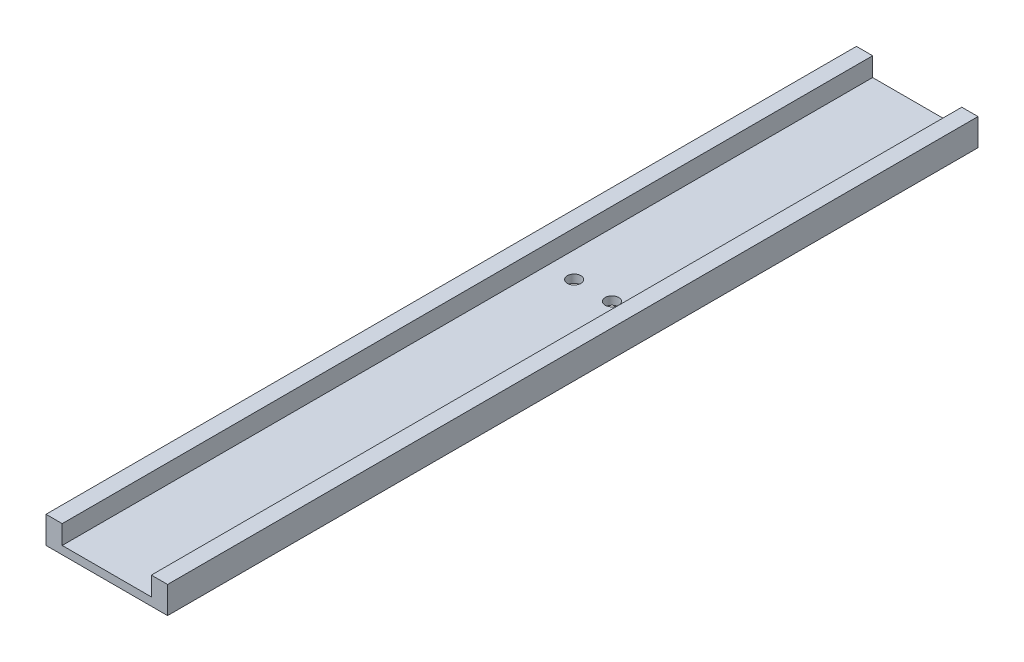
from build123d import *

# Parameters (mm, degrees)
BOSS_EXTRU_1_DEPTH           = 300
ENL_V_MAT_EXTRU_1_DEPTH      = 304.43697863
ENL_V_MAT_EXTRU_1_DEPTH_BACK = 304.43697863
ESQUISSE2_R                  = 2.5


with BuildPart() as part:
    # Esquisse1 → Boss.-Extru.1 (new body)
    with BuildSketch(Plane.XY):
        Polygon((0, 0), (0, 10), (6, 10), (6, 3), (39, 3), (39, 10), (45, 10), (45, 0), align=None)
    extrude(amount=BOSS_EXTRU_1_DEPTH)

    # Esquisse2 → Enlèv. mat.-Extru.1 (cut, two sides: drawn at the far end of the back side and taken through both)
    with BuildSketch(Plane(origin=(0, 3, 0), x_dir=(1, 0, 0), z_dir=(0, 1, 0)).offset(-ENL_V_MAT_EXTRU_1_DEPTH_BACK)):
        with Locations((15.5, -120)):
            Circle(ESQUISSE2_R)
        with Locations((29.5, -120)):
            Circle(ESQUISSE2_R)
    extrude(amount=ENL_V_MAT_EXTRU_1_DEPTH + ENL_V_MAT_EXTRU_1_DEPTH_BACK, mode=Mode.SUBTRACT)


solid = part.part
